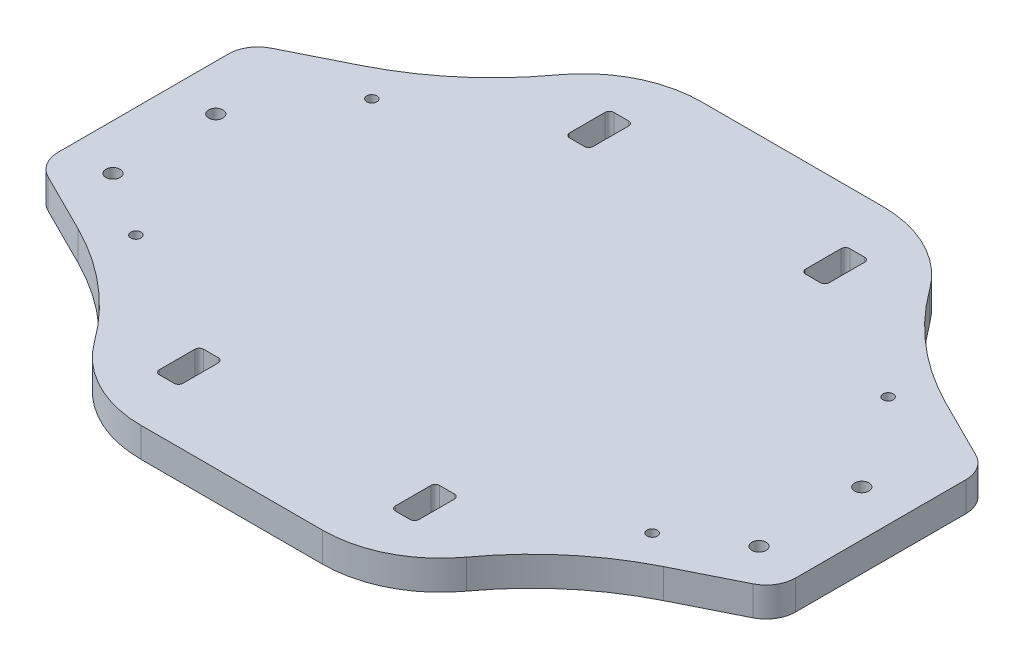
from build123d import *

# Parameters (mm, degrees)
SKETCH2_W           = 8
SKETCH2_H           = 15
SKETCH2_R           = 1.75
SKETCH2_R_2         = 2.425
BOSS_EXTRUDE1_DEPTH = 10
FILLET1_R           = 10
FILLET2_R           = 40
FILLET4_R           = 1.5
FILLET3_R           = 100


with BuildPart() as part:
    # Sketch2 → Boss-Extrude1 (new body)
    with BuildSketch(Plane(origin=(0, 0, 0), x_dir=(1, 0, 0), z_dir=(0, 1, 0))):
        Polygon((70, 95), (-70, 95), (-70, 62.51255638), (-125, 35.036306), (-125, -35.036306), (-70, -62.51255638), (-70, -95), (70, -95), (70, -62.51255638), (125, -35.036306), (125, 35.036306), (70, 62.51255638), align=None)
        with Locations((-40, -69.536306)):
            Rectangle(SKETCH2_W, SKETCH2_H, mode=Mode.SUBTRACT)
        with Locations(Location((-87.5, -40, 0), (0, 0, 270))):
            Circle(SKETCH2_R, mode=Mode.SUBTRACT)
        with Locations(Location((-109.5, -25.761306, 0), (0, 0, 270))):
            Circle(SKETCH2_R_2, mode=Mode.SUBTRACT)
        with Locations((40, -69.536306)):
            Rectangle(SKETCH2_W, SKETCH2_H, mode=Mode.SUBTRACT)
        with Locations(Location((87.5, -40, 0), (0, 0, 270))):
            Circle(SKETCH2_R, mode=Mode.SUBTRACT)
        with Locations(Location((109.5, -25.761306, 0), (0, 0, 270))):
            Circle(SKETCH2_R_2, mode=Mode.SUBTRACT)
        with Locations(Location((-109.5, 9.088694, 0), (0, 0, 270))):
            Circle(SKETCH2_R_2, mode=Mode.SUBTRACT)
        with Locations(Location((-87.5, 40, 0), (0, 0, 270))):
            Circle(SKETCH2_R, mode=Mode.SUBTRACT)
        with Locations((-40, 69.536306)):
            Rectangle(SKETCH2_W, SKETCH2_H, mode=Mode.SUBTRACT)
        with Locations(Location((109.5, 9.088694, 0), (0, 0, 270))):
            Circle(SKETCH2_R_2, mode=Mode.SUBTRACT)
        with Locations((40, 69.536306)):
            Rectangle(SKETCH2_W, SKETCH2_H, mode=Mode.SUBTRACT)
        with Locations(Location((87.5, 40, 0), (0, 0, 270))):
            Circle(SKETCH2_R, mode=Mode.SUBTRACT)
    extrude(amount=BOSS_EXTRUDE1_DEPTH)

    # Fillet1
    fillet1_edges = [part.edges().sort_by_distance(p)[0] for p in [
        (125, 5, 35.036306),
        (-125, 5, 35.036306),
        (-125, 5, -35.036306),
        (125, 5, -35.036306),
    ]]
    fillet(fillet1_edges, radius=FILLET1_R)

    # Fillet2
    # the kernel refuses this fillet: 40 mm, written as the material it takes off along each edge
    with BuildSketch(Plane(origin=(-70, -98.220463011, 95), x_dir=(0, 0, -1), z_dir=(0, 1, 0))) as fillet2_piece_1:
        with BuildLine():
            CenterArc((40, -39.288185204), FILLET2_R, 100.825233866, 79.174766134)
            Line((0, -39.288185204), (-0.8, -39.288185204))
            Line((-0.8, -39.288185204), (-0.8, 0))
            Line((-0.8, 0), (0, 0.8))
            ThreePointArc((0, 0.8), (16.24372181, 0.8), (32.337192493, 0.785763704))
            Line((32.337192493, 0.785763704), (32.48744362, 0))
        make_face()
    extrude(amount=206.440926021, mode=Mode.SUBTRACT)
    with BuildSketch(Plane(origin=(70, -98.220463011, 95), x_dir=(-1, 0, 0), z_dir=(0, 1, 0))) as fillet2_piece_2:
        with BuildLine():
            CenterArc((39.288185204, -40), FILLET2_R, 90, 79.174766134)
            Line((0, -32.48744362), (-0.785763704, -32.337192493))
            ThreePointArc((-0.785763704, -32.337192493), (-0.8, -16.24372181), (-0.8, 0))
            Line((-0.8, 0), (0, 0.8))
            Line((0, 0.8), (39.288185204, 0.8))
            Line((39.288185204, 0.8), (39.288185204, 0))
        make_face()
    extrude(amount=206.440926021, mode=Mode.SUBTRACT)
    with BuildSketch(Plane(origin=(70, -98.220463011, -95), x_dir=(-1, 0, 0), z_dir=(0, 1, 0))) as fillet2_piece_3:
        with BuildLine():
            CenterArc((39.288185204, 40), FILLET2_R, 190.825233866, 79.174766134)
            Line((0, 32.48744362), (-0.785763704, 32.337192493))
            ThreePointArc((-0.785763704, 32.337192493), (-0.8, 16.24372181), (-0.8, 0))
            Line((-0.8, 0), (0, -0.8))
            Line((0, -0.8), (39.288185204, -0.8))
            Line((39.288185204, -0.8), (39.288185204, 0))
        make_face()
    extrude(amount=206.440926021, mode=Mode.SUBTRACT)
    with BuildSketch(Plane(origin=(-70, -98.220463011, -95), x_dir=(0, 0, 1), z_dir=(0, 1, 0))) as fillet2_piece_4:
        with BuildLine():
            CenterArc((40, 39.288185204), FILLET2_R, 180, 79.174766134)
            Line((0, 39.288185204), (-0.8, 39.288185204))
            Line((-0.8, 39.288185204), (-0.8, 0))
            Line((-0.8, 0), (0, -0.8))
            ThreePointArc((0, -0.8), (16.24372181, -0.8), (32.337192493, -0.785763704))
            Line((32.337192493, -0.785763704), (32.48744362, 0))
        make_face()
    extrude(amount=206.440926021, mode=Mode.SUBTRACT)

    # Fillet4
    fillet4_edges = [part.edges().sort_by_distance(p)[0] for p in [
        (36, 5, 62.036306),
        (36, 5, 77.036306),
        (44, 5, 77.036306),
        (44, 5, 62.036306),
        (-36, 5, 62.036306),
        (-44, 5, 62.036306),
        (-44, 5, 77.036306),
        (-36, 5, 77.036306),
        (36, 5, -77.036306),
        (36, 5, -62.036306),
        (44, 5, -62.036306),
        (44, 5, -77.036306),
        (-44, 5, -77.036306),
        (-44, 5, -62.036306),
        (-36, 5, -62.036306),
        (-36, 5, -77.036306),
    ]]
    fillet(fillet4_edges, radius=FILLET4_R)

    # Fillet3
    fillet3_edges = [part.edges().sort_by_distance(p)[0] for p in [
        (70, 5, 62.51255638),
        (-70, 5, 62.51255638),
        (-70, 5, -62.51255638),
        (70, 5, -62.51255638),
    ]]
    fillet(fillet3_edges, radius=FILLET3_R)


solid = part.part
